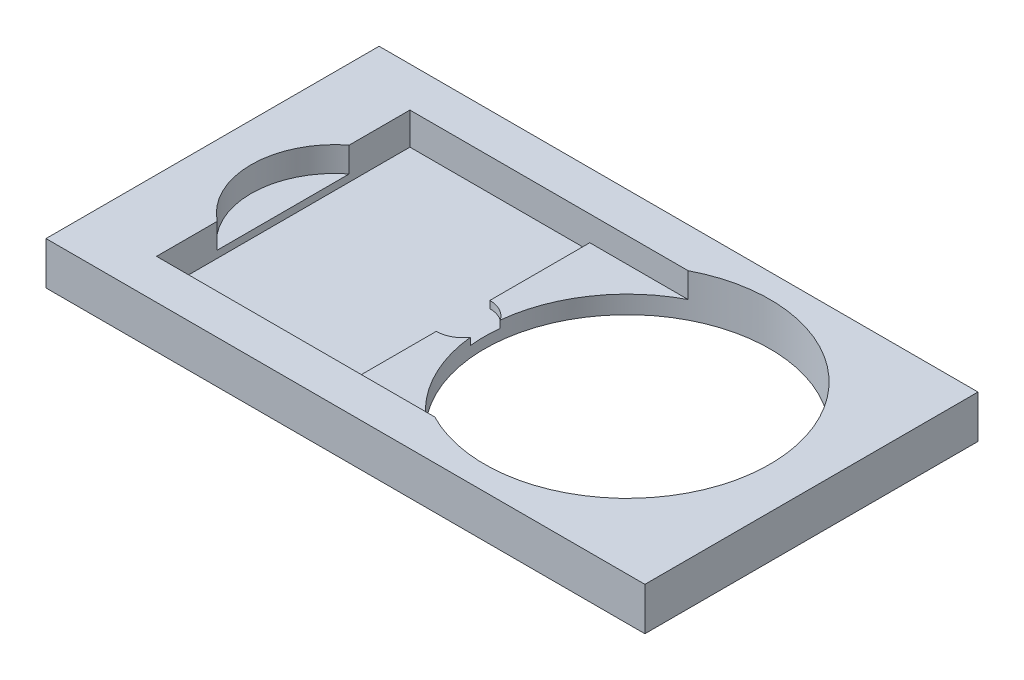
from build123d import *

# Parameters (mm, degrees)
SKETCH1_R               = 50
SKETCH1_R_2             = 10
BOSS_EXTRUDE1_DEPTH     = 3
BOSS_EXTRUDE2_DEPTH     = 2.5
CAVITY2_START           = 0.75
CAVITY2_DEPTH           = 2.25
CAVITY2_START_2         = 1.25
CAVITY2_2_DEPTH         = 1.75
FILLET1_R               = 0.5
FILLET2_R               = 7
CUT_EXTRUDE2_DEPTH      = 76.690157881
CUT_EXTRUDE2_DEPTH_BACK = 76.690157881
SKETCH3_R               = 50
SKETCH3_W               = 41.955661048
SKETCH3_H               = 23.335406012


# Read off the part's stored shape, not the designer's step: Cavity2
with BuildPart() as part:
    # Sketch1 → Boss-Extrude1 (new body)
    with BuildSketch(Plane(origin=(0, 0, 0), x_dir=(1, 0, 0), z_dir=(0, 1, 0))):
        with Locations(Location((0, 0, 0), (0, 0, 270))):
            Circle(SKETCH1_R)
        with Locations(Location((0, 0, 0), (0, 0, 270))):
            Circle(SKETCH1_R_2, mode=Mode.SUBTRACT)
    extrude(amount=BOSS_EXTRUDE1_DEPTH)

    # Sketch2 → Boss-Extrude2 (add, symmetric)
    with BuildSketch(Plane.XY.offset(-25)):
        Polygon((-17.5, 3), (-10.5, 3), (-10.5, 23), (30.5, 23), (30.5, 3), (37.5, 3), (37.5, 30), (-17.5, 30), align=None)
    extrude(amount=BOSS_EXTRUDE2_DEPTH, both=True)

    # Cavity2 outline → Cavity2 (cut)
    with BuildSketch(Plane(origin=(0, 0, 0), x_dir=(1, 0, 0), z_dir=(0, 1, 0)).offset(CAVITY2_START)):
        with BuildLine():
            ThreePointArc((-9.944972826, -1.047623734), (-10, 0), (-9.944972826, 1.047623734))
            ThreePointArc((-9.944972826, 1.047623734), (-10.619281402, 1.655282378), (-11.5, 1.875))
            Line((-11.5, 1.875), (-11.5, 8.875))
            Line((-11.5, 8.875), (-24.1, 8.875))
            Line((-24.1, 8.875), (-24.1, -8.875))
            Line((-24.1, -8.875), (-11.5, -8.875))
            Line((-11.5, -8.875), (-11.5, -1.875))
            ThreePointArc((-11.5, -1.875), (-10.619281402, -1.655282378), (-9.944972826, -1.047623734))
        make_face()
    extrude(amount=CAVITY2_DEPTH, mode=Mode.SUBTRACT)

    # Cavity2 2 outline → Cavity2 2 (cut)
    with BuildSketch(Plane(origin=(0, 0, 0), x_dir=(1, 0, 0), z_dir=(0, 1, 0)).offset(CAVITY2_START_2)):
        with BuildLine():
            ThreePointArc((-11.5, 1.875), (-10.619281402, 1.655282378), (-9.944972826, 1.047623734))
            ThreePointArc((-9.944972826, 1.047623734), (-8.262249735, 5.633402996), (-4.608077148, 8.875))
            Line((-4.608077148, 8.875), (-11.5, 8.875))
            Line((-11.5, 8.875), (-11.5, 1.875))
        make_face()
        with BuildLine():
            ThreePointArc((-4.608077148, -8.875), (-8.262249735, -5.633402996), (-9.944972826, -1.047623734))
            ThreePointArc((-9.944972826, -1.047623734), (-10.619281402, -1.655282378), (-11.5, -1.875))
            Line((-11.5, -1.875), (-11.5, -8.875))
            Line((-11.5, -8.875), (-4.608077148, -8.875))
        make_face()
        with BuildLine():
            Line((-24.1, -4.625), (-24.1, 4.625))
            ThreePointArc((-24.1, 4.625), (-26.35, 0), (-24.1, -4.625))
        make_face()
    extrude(amount=CAVITY2_2_DEPTH, mode=Mode.SUBTRACT)

    # Fillet1
    fillet1_edges = [part.edges().sort_by_distance(p)[0] for p in [
        (-14, 3, -22.5),
        (-17.5, 3, -25),
        (34, 3, -27.5),
        (37.5, 3, -25),
        (-14, 3, -27.5),
        (34, 3, -22.5),
    ]]
    fillet(fillet1_edges, radius=FILLET1_R)

    # Fillet2
    fillet2_edges = [part.edges().sort_by_distance(p)[0] for p in [
        (-17.5, 30, -25),
        (37.5, 30, -25),
    ]]
    fillet(fillet2_edges, radius=FILLET2_R)

    # Sketch3 → Cut-Extrude2 (cut, two sides: drawn at the far end of the back side and taken through both)
    with BuildSketch(Plane(origin=(0, 3, 0), x_dir=(1, 0, 0), z_dir=(0, 1, 0)).offset(-CUT_EXTRUDE2_DEPTH_BACK)):
        Circle(SKETCH3_R)
        with Locations((-8.073248433, 0)):
            Rectangle(SKETCH3_W, SKETCH3_H, mode=Mode.SUBTRACT)
    extrude(amount=CUT_EXTRUDE2_DEPTH + CUT_EXTRUDE2_DEPTH_BACK, mode=Mode.SUBTRACT)


solid = part.part
